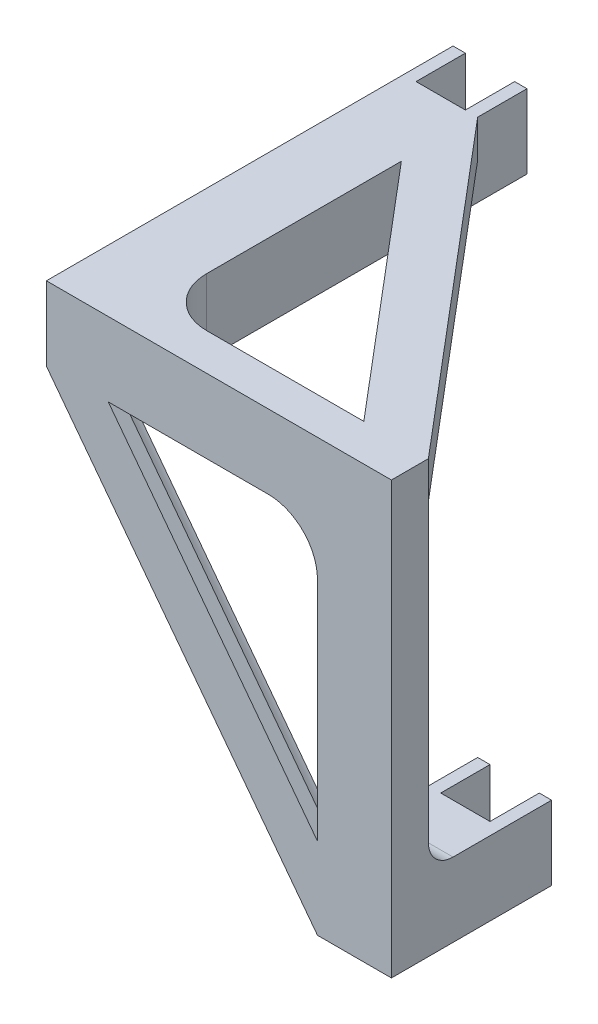
from build123d import *

# Parameters (mm, degrees)
SKETCH_1_W           = 140
SKETCH_1_H           = 175
EXTRUDE_1_DEPTH      = 150
SKETCH_2_W           = 110
SKETCH_2_H           = 145
CUT_EXTRUDE_1_DEPTH  = 150
SKETCH_3_W           = 115
SKETCH_3_H           = 145
CUT_EXTRUDE_2_DEPTH  = 150
SKETCH_4_W           = 110
SKETCH_4_H           = 135
CUT_EXTRUDE_3_DEPTH  = 150
SKETCH_5_W           = 20
SKETCH_5_H           = 40
CUT_EXTRUDE_4_DEPTH  = 150
SKETCH_6_W           = 20
SKETCH_6_H           = 115
CUT_EXTRUDE_5_DEPTH  = 150
EXTRUDE_2_DEPTH      = 30
CUT_EXTRUDE_6_DEPTH  = 30
SKETCH_9_W           = 30
SKETCH_9_H           = 30
CUT_EXTRUDE_7_DEPTH  = 15
SKETCH_10_W          = 20
SKETCH_10_H          = 60
CUT_EXTRUDE_8_DEPTH  = 20
EXTRUDE_3_DEPTH      = 5
EXTRUDE_4_DEPTH      = 5
EXTRUDE_1_2_DEPTH    = 10
EXTRUDE_2_2_DEPTH    = 10
FILLET_1_R           = 10
CUT_EXTRUDE_9_DEPTH  = 52
CUT_EXTRUDE_10_DEPTH = 52
FILLET_2_R           = 20
FILLET_3_R           = 10


with BuildPart() as part:
    # 草图1 → Extrude 1 (new body)
    with BuildSketch(Plane.XY):
        Rectangle(SKETCH_1_W, SKETCH_1_H)
    extrude(amount=EXTRUDE_1_DEPTH)

    # 草图2 → 切除-拉伸1 (cut)
    with BuildSketch(Plane.XY.offset(150)):
        with Locations((-15, -15)):
            Rectangle(SKETCH_2_W, SKETCH_2_H)
    extrude(amount=-CUT_EXTRUDE_1_DEPTH, mode=Mode.SUBTRACT)

    # 草图3 → 切除-拉伸2 (cut)
    with BuildSketch(Plane.ZY.offset(-40)):
        with Locations((57.5, -15)):
            Rectangle(SKETCH_3_W, SKETCH_3_H)
    extrude(amount=-CUT_EXTRUDE_2_DEPTH, mode=Mode.SUBTRACT)

    # 草图4 → 切除-拉伸3 (cut)
    with BuildSketch(Plane.XZ.offset(-57.5)):
        with Locations((15, 67.5)):
            Rectangle(SKETCH_4_W, SKETCH_4_H)
    extrude(amount=-CUT_EXTRUDE_3_DEPTH, mode=Mode.SUBTRACT)

    # 草图5 → 切除-拉伸4 (cut)
    with BuildSketch(Plane.XZ.offset(87.5)):
        with Locations((55, 115)):
            Rectangle(SKETCH_5_W, SKETCH_5_H)
    extrude(amount=-CUT_EXTRUDE_4_DEPTH, mode=Mode.SUBTRACT)

    # 草图6 → 切除-拉伸5 (cut)
    with BuildSketch(Plane.ZY.offset(-40)):
        with Locations((125, 0)):
            Rectangle(SKETCH_6_W, SKETCH_6_H)
    extrude(amount=-CUT_EXTRUDE_5_DEPTH, mode=Mode.SUBTRACT)

    # 草图7 → Extrude 2 (add)
    with BuildSketch(Plane.XY.offset(150)):
        Polygon((-70, 57.5), (40, 57.5), (40, -87.5), (70, -87.5), (70, 87.5), (-70, 87.5), align=None)
    extrude(amount=EXTRUDE_2_DEPTH)

    # 草图8 → 切除-拉伸6 (cut)
    with BuildSketch(Plane(origin=(0, 0, 135), x_dir=(-1, 0, 0), z_dir=(0, 0, -1))):
        Polygon((-65, -57.5), (-45, -57.5), (-40, -57.5), (-40, 57.5), (40, 57.5), (40, 87.5), (-70, 87.5), (-70, -57.5), align=None)
    extrude(amount=-CUT_EXTRUDE_6_DEPTH, mode=Mode.SUBTRACT)

    # 草图9 → 切除-拉伸7 (cut)
    with BuildSketch(Plane(origin=(0, 0, 0), x_dir=(-1, 0, 0), z_dir=(0, 0, -1))):
        with Locations((55, 72.5)):
            Rectangle(SKETCH_9_W, SKETCH_9_H)
    extrude(amount=-CUT_EXTRUDE_7_DEPTH, mode=Mode.SUBTRACT)

    # 草图10 → 切除-拉伸8 (cut)
    with BuildSketch(Plane(origin=(0, 0, 15), x_dir=(-1, 0, 0), z_dir=(0, 0, -1))):
        with Locations((55, 87.5)):
            Rectangle(SKETCH_10_W, SKETCH_10_H)
    extrude(amount=-CUT_EXTRUDE_8_DEPTH, mode=Mode.SUBTRACT)

    # 草图11 → 凸台-拉伸3 (add)
    with BuildSketch(Plane(origin=(0, 87.5, 0), x_dir=(1, 0, 0), z_dir=(0, 1, 0))):
        Polygon((-40, -35), (70, -165), (-40, -165), align=None)
    extrude(amount=-EXTRUDE_3_DEPTH)

    # 草图12 → 凸台-拉伸4 (add)
    with BuildSketch(Plane.XY.offset(180)):
        Polygon((-70, 57.5), (40, -87.5), (40, 57.5), align=None)
    extrude(amount=-EXTRUDE_4_DEPTH)

    # 草图13 → Extrude 1 2 (add)
    with BuildSketch(Plane(origin=(0, 0, 175), x_dir=(-1, 0, 0), z_dir=(0, 0, -1))):
        Polygon((70, 57.5), (-40, -87.5), (-47.966912709, -81.456135186), (62.033087291, 63.543864814), align=None)
    extrude(amount=EXTRUDE_1_2_DEPTH)

    # 草图14 → Extrude 2 2 (add)
    with BuildSketch(Plane.XZ.offset(-82.5)):
        Polygon((-40, 35), (70, 165), (62.366137146, 171.459422415), (-47.633862854, 41.459422415), align=None)
    extrude(amount=EXTRUDE_2_2_DEPTH)

    # 圆角1
    fillet_1_edges = [part.edges().sort_by_distance(p)[0] for p in [
        (8.450236013, 82.5, 107.740630166),
        (-8.724043199, -6.727147853, 175),
    ]]
    fillet(fillet_1_edges, radius=FILLET_1_R - 0.0001)  # a hair under: the kernel refuses the full size

    # 草图15 → 切除-拉伸9 (cut)
    with BuildSketch(Plane(origin=(0, 0, 175), x_dir=(-1, 0, 0), z_dir=(0, 0, -1))):
        Polygon((-40, 57.5), (-40, -54.408591412), (44.896172796, 57.5), align=None)
    extrude(amount=-CUT_EXTRUDE_9_DEPTH, mode=Mode.SUBTRACT)

    # 草图16 → 切除-拉伸10 (cut)
    with BuildSketch(Plane.XZ.offset(-82.5)):
        Polygon((-40, 165), (-40, 65.962520665), (43.800944052, 165), align=None)
    extrude(amount=-CUT_EXTRUDE_10_DEPTH, mode=Mode.SUBTRACT)

    # 圆角2
    fillet_2_edges = [part.edges().sort_by_distance(p)[0] for p in [
        (40, 57.5, 172.5),
        (-40, 72.5, 165),
    ]]
    fillet(fillet_2_edges, radius=FILLET_2_R)

    # 圆角3
    fillet_3_edges = [part.edges().sort_by_distance(p)[0] for p in [
        (55, -57.5, 165),
    ]]
    fillet(fillet_3_edges, radius=FILLET_3_R)


solid = part.part
